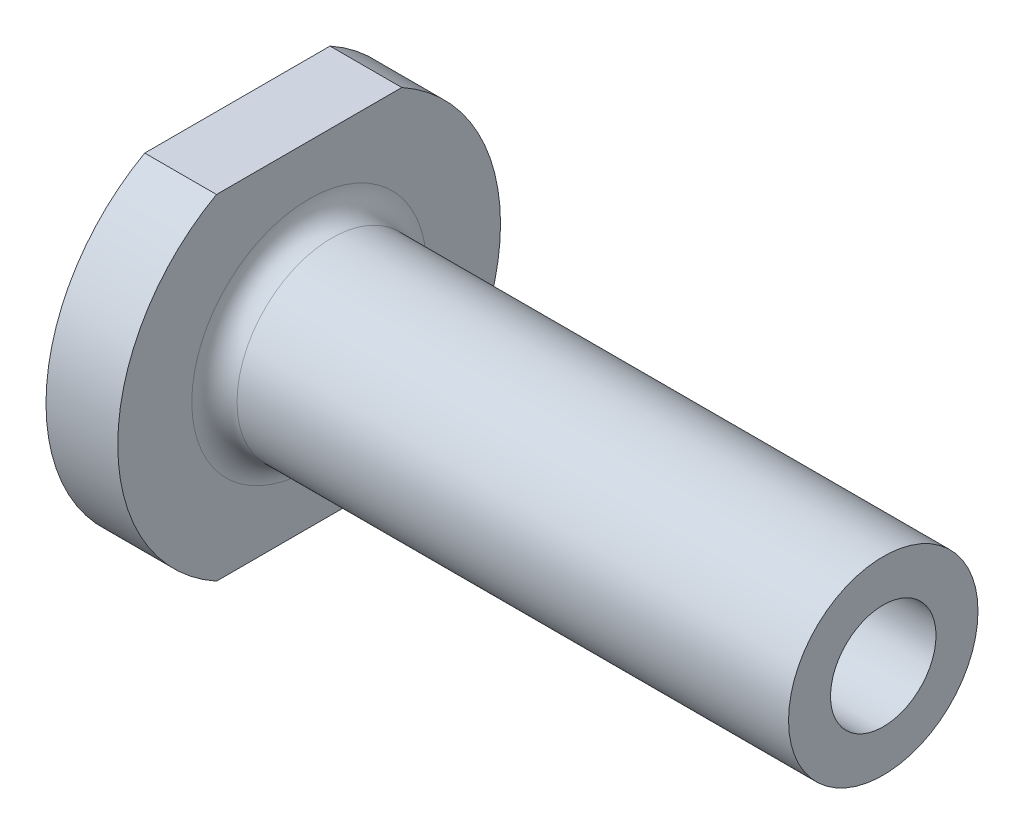
from build123d import *

# Parameters (mm, degrees)
FILLET1_R             = 1.5
HOLE_WIZARD_5_16_18_D = 7
CUT_EXTRUDE1_DEPTH    = 47.473367709


with BuildPart() as part:
    # Sketch1 → Revolve1 (revolve)
    with BuildSketch(Plane.XY):
        Polygon((0, 0), (42.8625, 0), (42.8625, 6.2865), (4.7625, 6.2865), (4.7625, 12.7), (0, 12.7), align=None)
    revolve(axis=Axis((0, 0, 0), (-1, 0, 0)))

    # Fillet1
    fillet1_edges = [part.edges().sort_by_distance(p)[0] for p in [
        (4.7625, -6.2865, 0),
    ]]
    fillet(fillet1_edges, radius=FILLET1_R)

    # 5/16-18 (through all)
    with Locations(Plane(origin=(42.8625, 0, 0), x_dir=(0, 0, -1), z_dir=(1, 0, 0))):
        with Locations((0, 0)):
            Hole(HOLE_WIZARD_5_16_18_D / 2)

    # Sketch4 → Cut-Extrude1 (cut, through all)
    with BuildSketch(Plane.ZY):
        with BuildLine():
            Line((-6.148361062, 11.1125), (6.148361062, 11.1125))
            ThreePointArc((6.148361062, 11.1125), (0, 12.7), (-6.148361062, 11.1125))
        make_face()
        with BuildLine():
            Line((6.148361062, -11.1125), (-6.148361062, -11.1125))
            ThreePointArc((-6.148361062, -11.1125), (0, -12.7), (6.148361062, -11.1125))
        make_face()
    extrude(amount=-CUT_EXTRUDE1_DEPTH, mode=Mode.SUBTRACT)


solid = part.part
